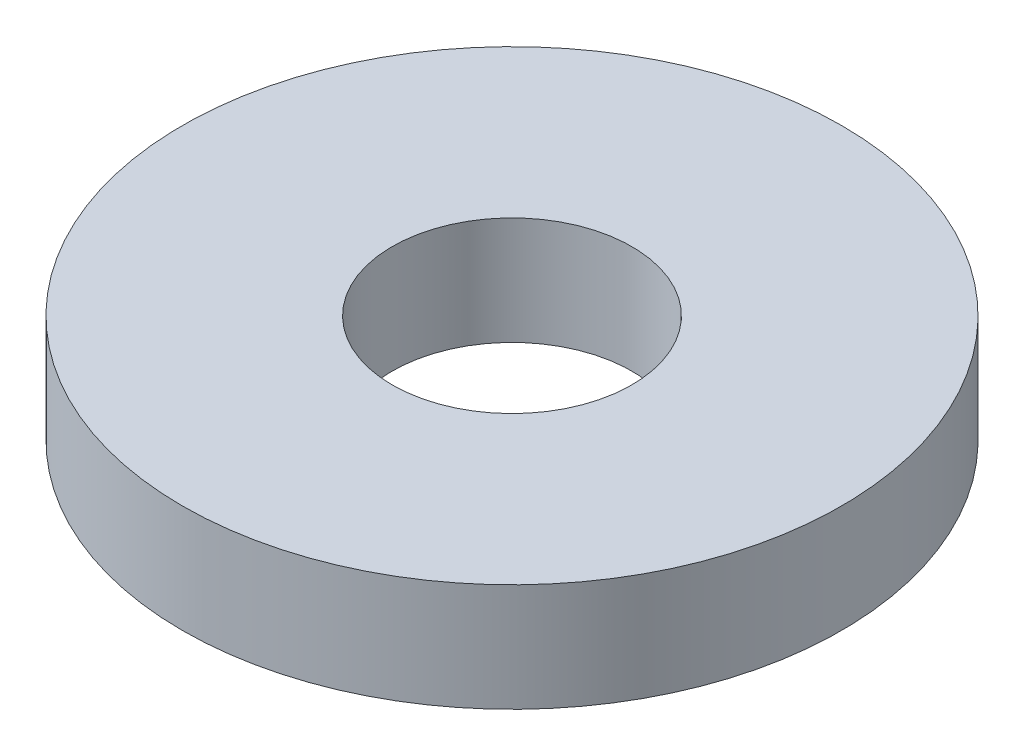
from build123d import *

# Parameters (mm, degrees)
SKETCH1_R           = 27.5
BOSS_EXTRUDE1_DEPTH = 9
SKETCH2_R           = 10
CUT_EXTRUDE1_DEPTH  = 40.918667312


with BuildPart() as part:
    # Sketch1 → Boss-Extrude1 (new body)
    with BuildSketch(Plane(origin=(0, 0, 0), x_dir=(1, 0, 0), z_dir=(0, 1, 0))):
        Circle(SKETCH1_R)
    extrude(amount=BOSS_EXTRUDE1_DEPTH)

    # Sketch2 → Cut-Extrude1 (cut, through all)
    with BuildSketch(Plane(origin=(0, 0, 0), x_dir=(1, 0, 0), z_dir=(0, 1, 0))):
        Circle(SKETCH2_R)
    extrude(amount=CUT_EXTRUDE1_DEPTH, mode=Mode.SUBTRACT)


solid = part.part
